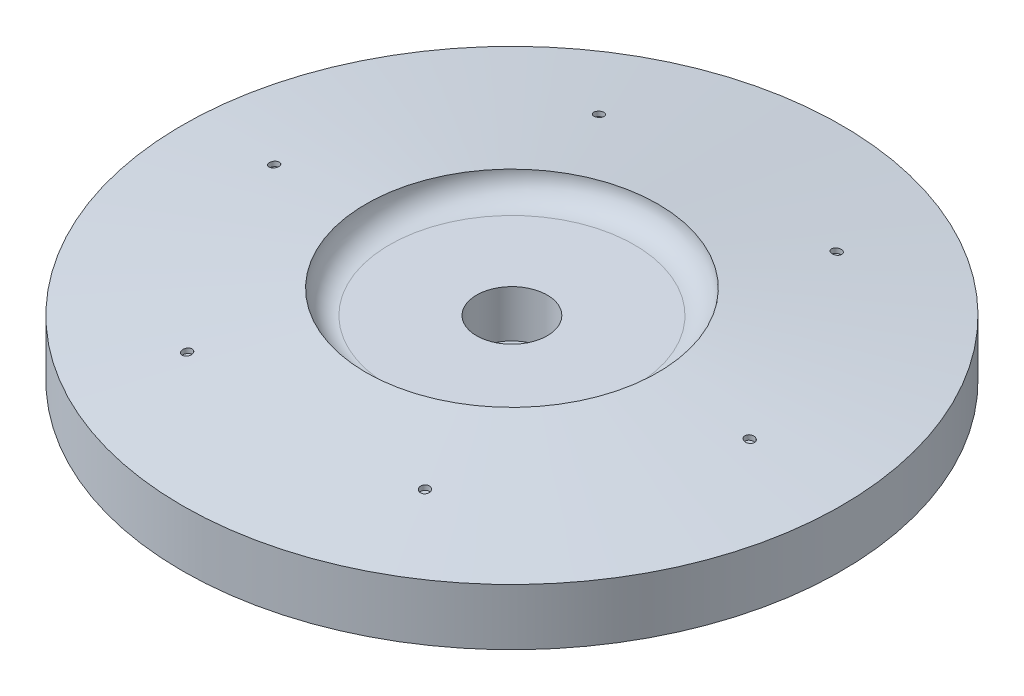
from build123d import *

# Parameters (mm, degrees)
SKETCH1_R           = 88.9
BOSS_EXTRUDE1_DEPTH = 15.24
SKETCH2_R           = 39.37
BOSS_EXTRUDE2_DEPTH = 6.35
SKETCH4_R           = 39.37
CUT_EXTRUDE1_DEPTH  = 6.35
FILLET1_R           = 6.35
SKETCH5_R           = 9.525
CUT_EXTRUDE2_DEPTH  = 12.7
SKETCH8_R           = 1.27
CUT_EXTRUDE3_DEPTH  = 6.35
CIRPATTERN1_COUNT   = 6
SKETCH9_R           = 12.7
BOSS_EXTRUDE3_DEPTH = 12.7


# Read off the part's stored shape, not the designer's step: Shell1
with BuildPart() as part:
    # Sketch1 → Boss-Extrude1 (new body)
    with BuildSketch(Plane(origin=(0, 0, 0), x_dir=(1, 0, 0), z_dir=(0, 1, 0))):
        with Locations(Location((0, 0, 0), (0, 0, 270))):
            Circle(SKETCH1_R)
    extrude(amount=BOSS_EXTRUDE1_DEPTH)

    # Sketch2 → Boss-Extrude2 (add)
    with BuildSketch(Plane(origin=(0, 15.24, 0), x_dir=(1, 0, 0), z_dir=(0, 1, 0))):
        with Locations(Location((0, 0, 0), (0, 0, 270))):
            Circle(SKETCH2_R)
    extrude(amount=BOSS_EXTRUDE2_DEPTH)

    # Sketch3 → Revolve1 (revolve)
    with BuildSketch(Plane(origin=(0, 0, 0), x_dir=(0, 0, -1), z_dir=(1, 0, 0)), mode=Mode.PRIVATE) as revolve1_sk:
        Polygon((-39.37, 21.59), (-39.37, 15.24), (-88.9, 15.24), align=None)
    revolve(revolve1_sk.sketch.rotate(Axis((0, 0, 0), (0, 1, 0)), 180), axis=Axis((0, 0, 0), (0, 1, 0)))

    # Sketch4 → Cut-Extrude1 (cut)
    with BuildSketch(Plane(origin=(0, 21.59, 0), x_dir=(1, 0, 0), z_dir=(0, 1, 0))):
        with Locations(Location((0, 0, 0), (0, 0, 270))):
            Circle(SKETCH4_R)
    extrude(amount=-CUT_EXTRUDE1_DEPTH, mode=Mode.SUBTRACT)

    # Fillet1
    fillet1_edges = [part.edges().sort_by_distance(p)[0] for p in [
        (0, 15.24, -39.37),
    ]]
    fillet(fillet1_edges, radius=FILLET1_R - 0.0001)  # a hair under: the kernel refuses the full size

    # Sketch5 → Cut-Extrude2 (cut)
    with BuildSketch(Plane(origin=(0, 15.24, 0), x_dir=(1, 0, 0), z_dir=(0, 1, 0))):
        with Locations(Location((0, 0, 0), (0, 0, 270))):
            Circle(SKETCH5_R)
    extrude(amount=-CUT_EXTRUDE2_DEPTH, mode=Mode.SUBTRACT)

    # Shell1 outline → Shell1 (revolve, cut)
    with BuildSketch(Plane.XY):
        with BuildLine():
            Line((87.63, 14.12242584), (40.505388812, 20.164042659))
            ThreePointArc((40.505388812, 20.164042659), (37.877911334, 15.71930179), (33.02, 13.97))
            Line((33.02, 13.97), (10.795, 13.97))
            Line((10.795, 13.97), (10.795, 2.54))
            Line((10.795, 2.54), (0, 2.54))
            Line((0, 2.54), (0, 1.27))
            Line((0, 1.27), (87.63, 1.27))
            Line((87.63, 1.27), (87.63, 14.12242584))
        make_face()
    revolve(axis=Axis((0, 0, 0), (0, 1, 0)), mode=Mode.SUBTRACT)

    # Sketch8 → Cut-Extrude3 (cut)
    with BuildSketch(Plane(origin=(0, 15.24, 0), x_dir=(-1, 0, 0), z_dir=(0, -1, 0))):
        with Locations(Location((-64.135, 0, 0), (0, 0, 65.776295288))):
            Circle(SKETCH8_R)
    cut_extrude3 = extrude(amount=-CUT_EXTRUDE3_DEPTH, mode=Mode.SUBTRACT)

    # CirPattern1: Cut-Extrude3 ×6 about axis
    cirpattern1_axis = Axis((0, 0, 0), (0, 1, 0))
    for i in range(1, CIRPATTERN1_COUNT):
        add(cut_extrude3.rotate(cirpattern1_axis, i * 360 / CIRPATTERN1_COUNT), mode=Mode.SUBTRACT)

    # Sketch9 → Boss-Extrude3 (add)
    with BuildSketch(Plane.XZ):
        with Locations(Location((0, 0, 0), (0, 0, 90))):
            Circle(SKETCH9_R)
    extrude(amount=BOSS_EXTRUDE3_DEPTH)


solid = part.part
